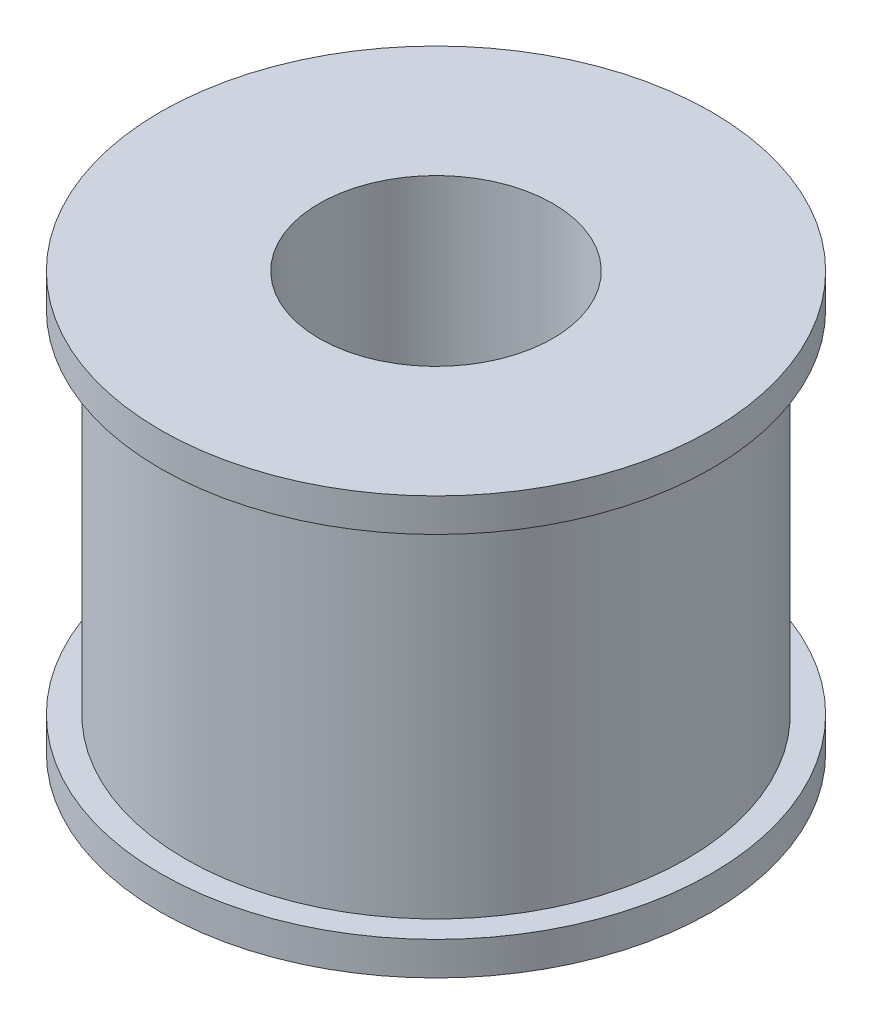
from build123d import *

# Parameters (mm, degrees)
CROQUIS1_R              = 15
CROQUIS1_R_2            = 3
SALIENTE_EXTRUIR1_DEPTH = 25
CROQUIS2_R              = 16.5
CROQUIS2_R_2            = 3
SALIENTE_EXTRUIR2_DEPTH = 2
SALIENTE_EXTRUIR3_START = -2
CROQUIS3_R              = 16.5
CROQUIS3_R_2            = 3
SALIENTE_EXTRUIR3_DEPTH = 2
CORTAR_EXTRUIR1_REACH   = 36.198
CROQUIS4_R              = 1.625
CROQUIS5_R              = 7
CORTAR_EXTRUIR2_DEPTH   = 16


with BuildPart() as part:
    # Croquis1 → Saliente-Extruir1 (new body)
    with BuildSketch(Plane(origin=(0, 0, 0), x_dir=(1, 0, 0), z_dir=(0, 1, 0))):
        Circle(CROQUIS1_R)
        Circle(CROQUIS1_R_2, mode=Mode.SUBTRACT)
    extrude(amount=SALIENTE_EXTRUIR1_DEPTH)

    # Croquis2 → Saliente-Extruir2 (add)
    with BuildSketch(Plane.XZ):
        Circle(CROQUIS2_R)
        Circle(CROQUIS2_R_2, mode=Mode.SUBTRACT)
    extrude(amount=-SALIENTE_EXTRUIR2_DEPTH)

    # Croquis3 → Saliente-Extruir3 (add)
    with BuildSketch(Plane(origin=(0, 25, 0), x_dir=(1, 0, 0), z_dir=(0, 1, 0)).offset(SALIENTE_EXTRUIR3_START)):
        Circle(CROQUIS3_R)
        Circle(CROQUIS3_R_2, mode=Mode.SUBTRACT)
    extrude(amount=SALIENTE_EXTRUIR3_DEPTH)

    # Croquis4 → Cortar-Extruir1 (cut, up to next)
    with BuildSketch(Plane.XY, mode=Mode.PRIVATE) as cortar_extruir1_sk1:
        with Locations((0, 5)):
            Circle(CROQUIS4_R)
    cortar_extruir1_tool1 = extrude(cortar_extruir1_sk1.sketch, amount=-CORTAR_EXTRUIR1_REACH, mode=Mode.PRIVATE) & part.part
    add(cortar_extruir1_tool1.solids().sort_by_distance((0, 5, 0))[0], mode=Mode.SUBTRACT)

    # Croquis5 → Cortar-Extruir2 (cut)
    with BuildSketch(Plane(origin=(0, 25, 0), x_dir=(1, 0, 0), z_dir=(0, 1, 0))):
        Circle(CROQUIS5_R)
    extrude(amount=-CORTAR_EXTRUIR2_DEPTH, mode=Mode.SUBTRACT)


solid = part.part
